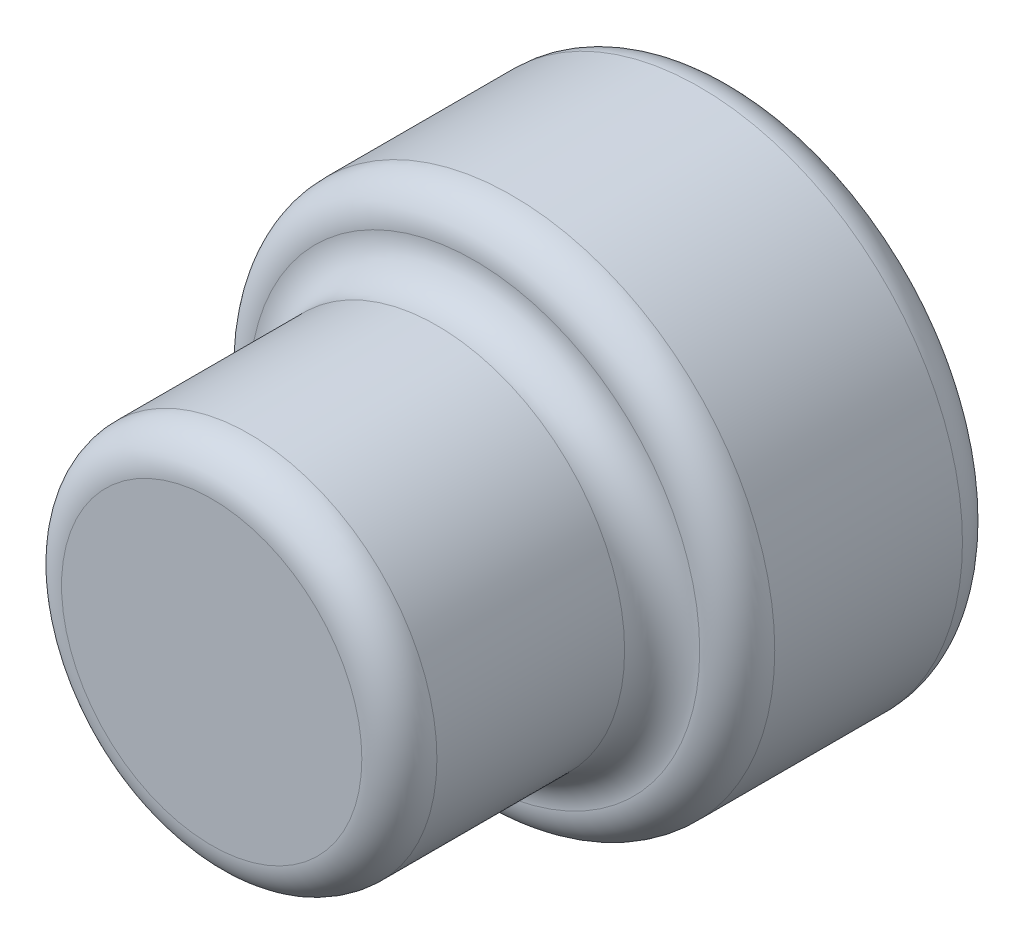
from build123d import *

# Parameters (mm, degrees)
SKETCH1_R           = 7
BOSS_EXTRUDE1_DEPTH = 7
FILLET1_R           = 1
SKETCH2_R           = 5
BOSS_EXTRUDE2_DEPTH = 7
FILLET2_R           = 1


with BuildPart() as part:
    # Sketch1 → Boss-Extrude1 (new body)
    with BuildSketch(Plane.XY):
        Circle(SKETCH1_R)
    extrude(amount=BOSS_EXTRUDE1_DEPTH)

    # Fillet1
    fillet1_edges = [part.edges().sort_by_distance(p)[0] for p in [
        (-7, 0, 0),
        (-7, 0, 7),
    ]]
    fillet(fillet1_edges, radius=FILLET1_R)

    # Sketch2 → Boss-Extrude2 (add)
    with BuildSketch(Plane.XY.offset(7)):
        Circle(SKETCH2_R)
    extrude(amount=BOSS_EXTRUDE2_DEPTH)

    # Fillet2
    fillet2_edges = [part.edges().sort_by_distance(p)[0] for p in [
        (-5, 0, 7),
        (-5, 0, 14),
    ]]
    fillet(fillet2_edges, radius=FILLET2_R - 0.0001)  # a hair under: the kernel refuses the full size


solid = part.part
